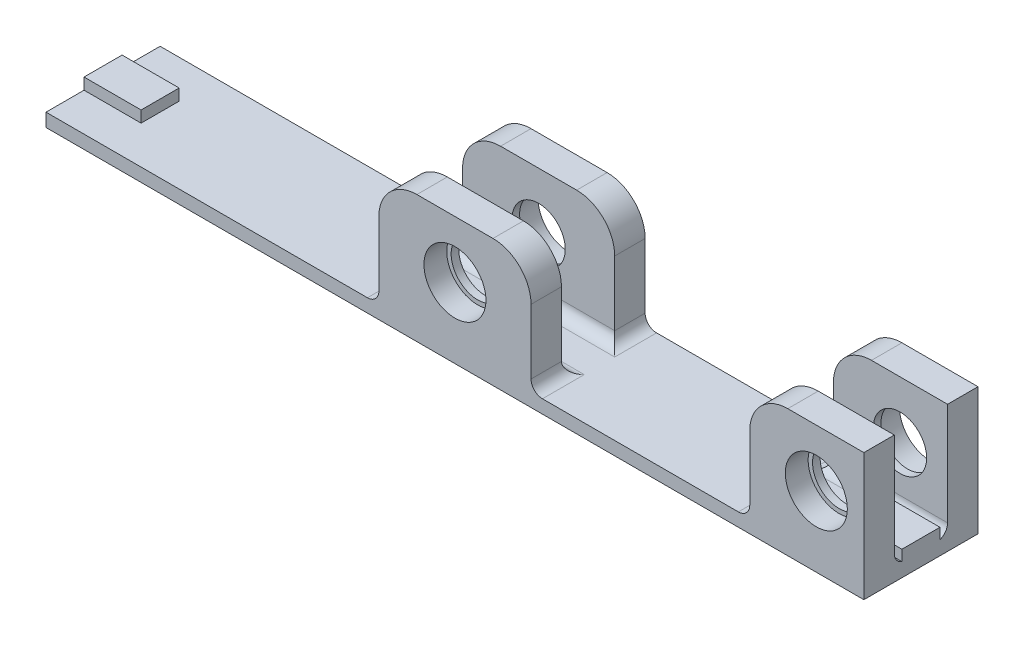
from build123d import *

# Parameters (mm, degrees)
SKETCH2_W           = 215
SKETCH2_H           = 30
BOSS_EXTRUDE1_DEPTH = 3.5
SKETCH4_W           = 30
SKETCH4_H           = 8
SKETCH4_W_2         = 40
BOSS_EXTRUDE2_DEPTH = 30
SKETCH5_R           = 8.15
BEARING_HOLES_DEPTH = 6
SKETCH7_R           = 7
CUT_EXTRUDE2_DEPTH  = 116.128189424
FILLET1_R           = 10
HOLES_TBD_R         = 1.65
CUT_EXTRUDE1_DEPTH  = 113.611056296
SKETCH6_W           = 15
SKETCH6_H           = 10
BOSS_EXTRUDE3_DEPTH = 3
FILLET2_R           = 3


with BuildPart() as part:
    # Sketch2 → Boss-Extrude1 (new body)
    with BuildSketch(Plane(origin=(0, 0, 0), x_dir=(1, 0, 0), z_dir=(0, 1, 0))):
        Rectangle(SKETCH2_W, SKETCH2_H)
    extrude(amount=BOSS_EXTRUDE1_DEPTH)

    # Sketch4 → Boss-Extrude2 (add)
    with BuildSketch(Plane(origin=(0, 3.5, 0), x_dir=(1, 0, 0), z_dir=(0, 1, 0))):
        with Locations((92.5, -11)):
            Rectangle(SKETCH4_W, SKETCH4_H)
        with Locations((0, -11)):
            Rectangle(SKETCH4_W_2, SKETCH4_H)
        with Locations((0, 11)):
            Rectangle(SKETCH4_W_2, SKETCH4_H)
        with Locations((92.5, 11)):
            Rectangle(SKETCH4_W, SKETCH4_H)
    extrude(amount=BOSS_EXTRUDE2_DEPTH)

    # Sketch5 → Bearing holes (cut)
    with BuildSketch(Plane.XY.offset(15)):
        with Locations((0, 18.5)):
            Circle(SKETCH5_R)
        with Locations((95, 18.5)):
            Circle(SKETCH5_R)
    bearing_holes = extrude(amount=-BEARING_HOLES_DEPTH, mode=Mode.SUBTRACT)

    # Mirror1: Bearing holes across plane
    add(bearing_holes.mirror(Plane.XY), mode=Mode.SUBTRACT)

    # Sketch7 → Cut-Extrude2 (cut, through all)
    with BuildSketch(Plane.XY.offset(9)):
        with Locations((0, 18.5)):
            Circle(SKETCH7_R)
        with Locations((95, 18.5)):
            Circle(SKETCH7_R)
    extrude(amount=-CUT_EXTRUDE2_DEPTH, mode=Mode.SUBTRACT)

    # Fillet1
    fillet1_edges = [part.edges().sort_by_distance(p)[0] for p in [
        (-20, 33.5, 11),
        (-20, 33.5, -11),
        (20, 33.5, -11),
        (20, 33.5, 11),
        (77.5, 33.5, 11),
        (77.5, 33.5, -11),
    ]]
    fillet(fillet1_edges, radius=FILLET1_R)

    # HOLES TBD → Cut-Extrude1 (cut, through all)
    with BuildSketch(Plane(origin=(0, 3.5, 0), x_dir=(1, 0, 0), z_dir=(0, 1, 0))):
        with Locations((-100, 0)):
            Circle(HOLES_TBD_R)
        with Locations((100, 0)):
            Circle(HOLES_TBD_R)
    extrude(amount=-CUT_EXTRUDE1_DEPTH, mode=Mode.SUBTRACT)

    # Sketch6 → Boss-Extrude3 (add)
    with BuildSketch(Plane(origin=(0, 3.5, 0), x_dir=(1, 0, 0), z_dir=(0, 1, 0))):
        with Locations((-100, 0)):
            Rectangle(SKETCH6_W, SKETCH6_H)
        with Locations((100, 0)):
            Rectangle(SKETCH6_W, SKETCH6_H)
    extrude(amount=BOSS_EXTRUDE3_DEPTH)

    # Fillet2
    fillet2_edges = [part.edges().sort_by_distance(p)[0] for p in [
        (77.5, 3.5, 11),
        (92.5, 3.5, 7),
        (92.5, 3.5, -7),
        (77.5, 3.5, -11),
        (20, 3.5, 11),
        (20, 3.5, -11),
        (-20, 3.5, 11),
        (-20, 3.5, -11),
        (0, 3.5, 7),
        (0, 3.5, -7),
    ]]
    fillet(fillet2_edges, radius=FILLET2_R)


solid = part.part
